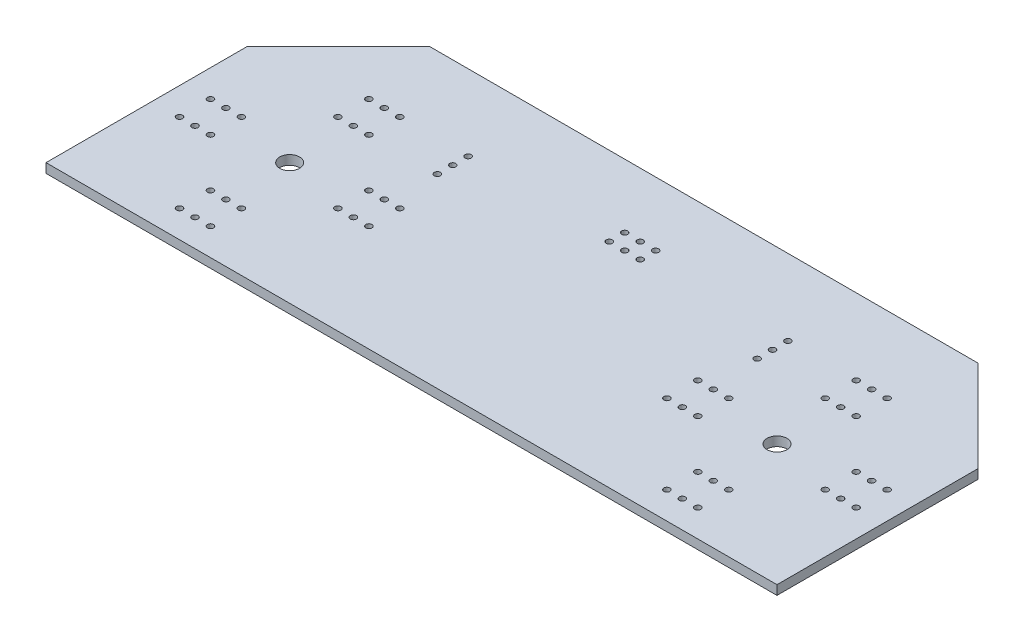
from build123d import *

# Parameters (mm, degrees)
SKETCH1_W           = 120
SKETCH1_H           = 48
BOSS_EXTRUDE1_DEPTH = 1.53
SKETCH2_R           = 0.5
SKETCH2_R_2         = 1.625
CUT_EXTRUDE1_DEPTH  = 67.229456437
SKETCH5_R           = 0.5
CUT_EXTRUDE2_DEPTH  = 67.229456437
CUT_EXTRUDE4_DEPTH  = 67.229456437
SKETCH7_R           = 0.5
CUT_EXTRUDE5_DEPTH  = 67.229456437


with BuildPart() as part:
    # Sketch1 → Boss-Extrude1 (new body)
    with BuildSketch(Plane(origin=(0, 0, 0), x_dir=(1, 0, 0), z_dir=(0, 1, 0))):
        with Locations((0, 4)):
            Rectangle(SKETCH1_W, SKETCH1_H)
    extrude(amount=BOSS_EXTRUDE1_DEPTH)

    # Sketch2 → Cut-Extrude1 (cut, through all)
    with BuildSketch(Plane(origin=(0, 1.53, 0), x_dir=(1, 0, 0), z_dir=(0, 1, 0))):
        with Locations((-55.54, 2.54)):
            Circle(SKETCH2_R)
        with Locations((-53, 2.54)):
            Circle(SKETCH2_R)
        with Locations((-50.46, 2.54)):
            Circle(SKETCH2_R)
        with Locations((-55.54, -2.54)):
            Circle(SKETCH2_R)
        with Locations((-53, -2.54)):
            Circle(SKETCH2_R)
        with Locations((-50.46, -2.54)):
            Circle(SKETCH2_R)
        with Locations((-29.54, 2.54)):
            Circle(SKETCH2_R)
        with Locations((-27, 2.54)):
            Circle(SKETCH2_R)
        with Locations((-24.46, 2.54)):
            Circle(SKETCH2_R)
        with Locations((-29.54, -2.54)):
            Circle(SKETCH2_R)
        with Locations((-27, -2.54)):
            Circle(SKETCH2_R)
        with Locations((-24.46, -2.54)):
            Circle(SKETCH2_R)
        with Locations((-42.54, 15.54)):
            Circle(SKETCH2_R)
        with Locations((-40, 15.54)):
            Circle(SKETCH2_R)
        with Locations((-37.46, 15.54)):
            Circle(SKETCH2_R)
        with Locations((-42.54, 10.46)):
            Circle(SKETCH2_R)
        with Locations((-40, 10.46)):
            Circle(SKETCH2_R)
        with Locations((-37.46, 10.46)):
            Circle(SKETCH2_R)
        with Locations((-42.54, -10.46)):
            Circle(SKETCH2_R)
        with Locations((-40, -10.46)):
            Circle(SKETCH2_R)
        with Locations((-37.46, -10.46)):
            Circle(SKETCH2_R)
        with Locations((-42.54, -15.54)):
            Circle(SKETCH2_R)
        with Locations((-40, -15.54)):
            Circle(SKETCH2_R)
        with Locations((-37.46, -15.54)):
            Circle(SKETCH2_R)
        with Locations((-40, 0)):
            Circle(SKETCH2_R_2)
    cut_extrude1 = extrude(amount=-CUT_EXTRUDE1_DEPTH, mode=Mode.SUBTRACT)

    # Mirror1: Cut-Extrude1 across plane
    add(cut_extrude1.mirror(Plane(origin=(0, 0, 0), x_dir=(0, 0, 1), z_dir=(1, 0, 0))), mode=Mode.SUBTRACT)

    # Sketch5 → Cut-Extrude2 (cut, through all)
    with BuildSketch(Plane(origin=(0, 1.53, 0), x_dir=(1, 0, 0), z_dir=(0, 1, 0))):
        with Locations((-2.54, 17.54)):
            Circle(SKETCH5_R)
        with Locations((0, 17.54)):
            Circle(SKETCH5_R)
        with Locations((2.54, 17.54)):
            Circle(SKETCH5_R)
        with Locations((-2.54, 15)):
            Circle(SKETCH5_R)
        with Locations((0, 15)):
            Circle(SKETCH5_R)
        with Locations((2.54, 15)):
            Circle(SKETCH5_R)
    extrude(amount=-CUT_EXTRUDE2_DEPTH, mode=Mode.SUBTRACT)

    # Sketch6 → Cut-Extrude4 (cut, through all)
    with BuildSketch(Plane(origin=(0, 1.53, 0), x_dir=(1, 0, 0), z_dir=(0, 1, 0))):
        Polygon((-60, 13), (-45, 28), (-60, 28), align=None)
        Polygon((45, 28), (60, 13), (60, 28), align=None)
    extrude(amount=-CUT_EXTRUDE4_DEPTH, mode=Mode.SUBTRACT)

    # Sketch7 → Cut-Extrude5 (cut, through all)
    with BuildSketch(Plane(origin=(0, 1.53, 0), x_dir=(1, 0, 0), z_dir=(0, 1, 0))):
        with Locations((-26.25, 15.54)):
            Circle(SKETCH7_R)
        with Locations((-26.25, 13.02)):
            Circle(SKETCH7_R)
        with Locations((-26.25, 10.5)):
            Circle(SKETCH7_R)
        with Locations((26.25, 10.5)):
            Circle(SKETCH7_R)
        with Locations((26.25, 13.02)):
            Circle(SKETCH7_R)
        with Locations((26.25, 15.54)):
            Circle(SKETCH7_R)
    extrude(amount=-CUT_EXTRUDE5_DEPTH, mode=Mode.SUBTRACT)


solid = part.part
